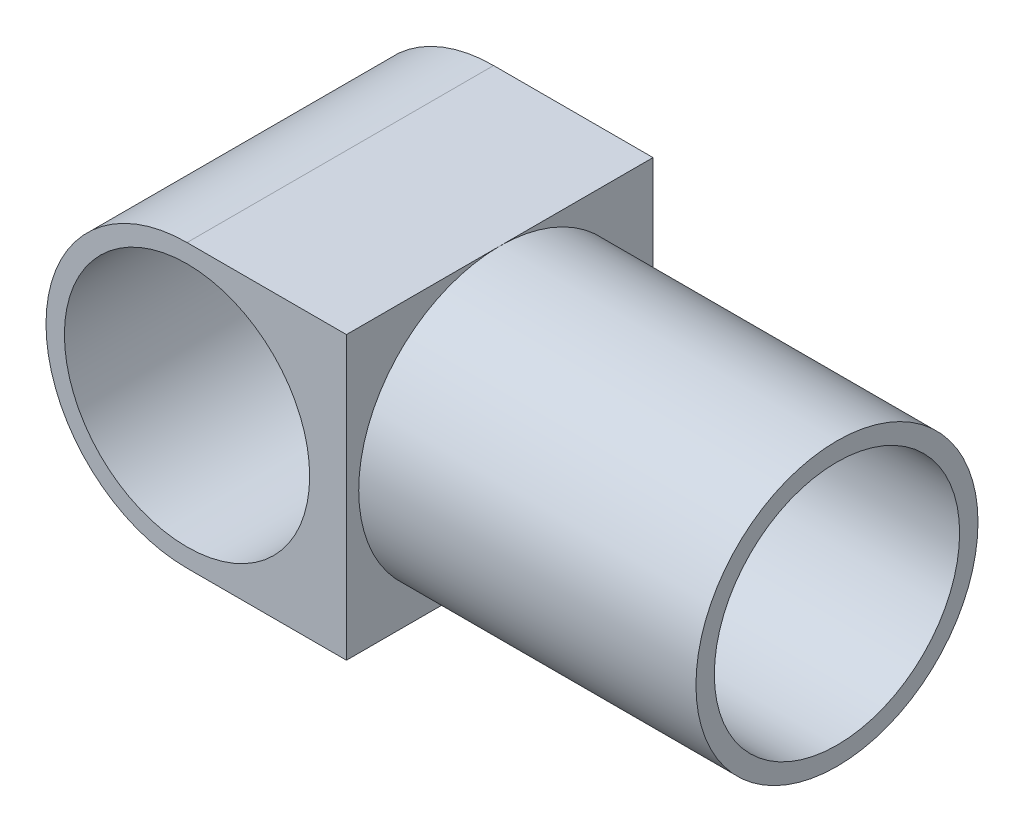
from build123d import *

# Parameters (mm, degrees)
SZKIC1_R                    = 10
DODANIE_WYCI_GNI_CIE1_DEPTH = 25
SZKIC2_R                    = 11.5
SZKIC2_R_2                  = 10
DODANIE_WYCI_GNI_CIE2_DEPTH = 27.5


with BuildPart() as part:
    # Szkic1 → Dodanie-wyciągnięcie1 (new body)
    with BuildSketch(Plane.XY):
        with BuildLine():
            Line((0, 11.5), (13, 11.5))
            Line((13, 11.5), (13, -11.5))
            Line((13, -11.5), (0, -11.5))
            ThreePointArc((0, -11.5), (-11.5, 0), (0, 11.5))
        make_face()
        Circle(SZKIC1_R, mode=Mode.SUBTRACT)
    extrude(amount=DODANIE_WYCI_GNI_CIE1_DEPTH)

    # Szkic2 → Dodanie-wyciągnięcie2 (add)
    with BuildSketch(Plane(origin=(13, 0, 0), x_dir=(0, 0, -1), z_dir=(1, 0, 0))):
        with Locations((-12.5, 0)):
            Circle(SZKIC2_R)
        with Locations((-12.5, 0)):
            Circle(SZKIC2_R_2, mode=Mode.SUBTRACT)
    extrude(amount=DODANIE_WYCI_GNI_CIE2_DEPTH)


solid = part.part
